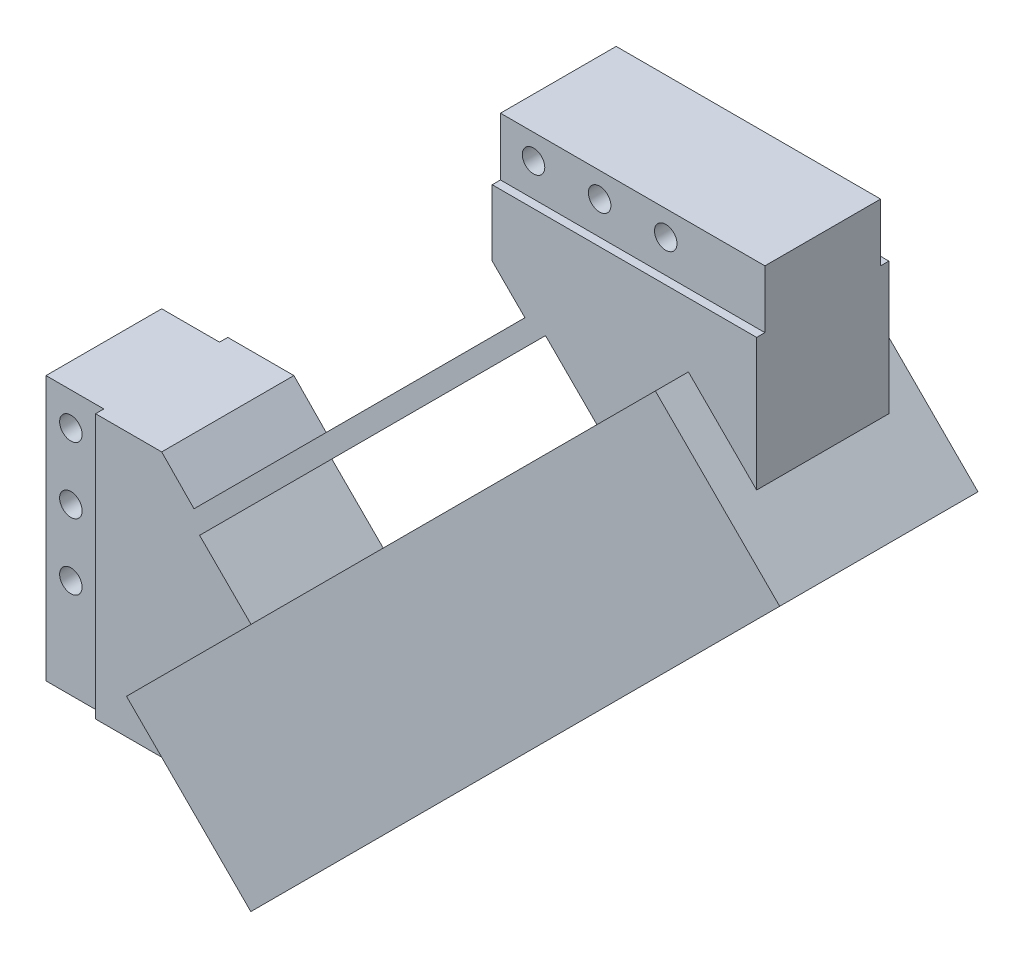
from build123d import *

# Parameters (mm, degrees)
SKETCH3_W                = 11.1125
SKETCH3_H                = 50.8
SKETCH3_W_2              = 50.8
SKETCH3_H_2              = 11.1125
BOSS_EXTRUDE2_DEPTH      = 25.4
SKETCH5_W                = 50.8
SKETCH5_H                = 12.7
SKETCH5_W_2              = 12.7
SKETCH5_H_2              = 50.8
CUT_EXTRUDE1_DEPTH       = 1.5875
SKETCH6_W                = 50.8
SKETCH6_H                = 12.7
SKETCH6_W_2              = 12.7
SKETCH6_H_2              = 50.8
CUT_EXTRUDE2_DEPTH       = 1.5875
SKETCH7_R                = 2.159
CUT_EXTRUDE4_DEPTH       = 25.4
F_3DSKETCH2_R            = 11.1125
F_3DSKETCH2_R_2          = 4.572
F_3DSKETCH2_R_3          = 19.05
F_3DSKETCH2_R_4          = 2.413
BOSS_EXTRUDE5_DEPTH      = 18.539434278
CUT_EXTRUDE9_START       = 89.71230509
CUT_EXTRUDE9_OUTLINE_R   = 4.572
CUT_EXTRUDE9_DEPTH       = 36.011280605
F_3DSKETCH2_11_R         = 2.413
CUT_EXTRUDE10_DEPTH      = 36.011280605
BOSS_EXTRUDE7_START      = -21.079434
SKETCH10_W               = 38.1
SKETCH10_H               = 143.684097938
SKETCH10_R               = 4.572
BOSS_EXTRUDE7_DEPTH      = 33.779434
CUT_EXTRUDE13_DEPTH      = 12.7
CUT_EXTRUDE13_DEPTH_BACK = 2.54
CUT_EXTRUDE14_DEPTH      = 12.7


# Read off the part's stored shape, not the designer's step: Cut-Extrude9
with BuildPart() as part:
    # Sketch3 → Boss-Extrude2 (new body)
    # profile 1 of 3: a face of its own
    with BuildSketch(Plane.XY):
        Polygon((139.7, -12.7), (88.9, -12.7), (88.9, -25.4), (95.186179285, -31.686179285), (92.898197138, -33.974161432), (33.974161432, -92.898197138), (31.605965948, -95.266392622), (25.4, -88.9), (12.7, -88.9), (12.7, -139.7), (38.1, -139.7), (139.7, -38.1), align=None)
        Polygon((109.017587951, -42.563692655), (42.563692655, -109.017587951), (35.379487758, -101.833383054), (32.685410922, -99.139306217), (42.563692655, -89.261024484), (89.261024484, -42.563692655), (99.139306217, -32.685410922), (101.833383054, -35.379487758), align=None, mode=Mode.SUBTRACT)
    # profile 2 of 3: a face of its own
    with BuildSketch(Plane.XY):
        with Locations((7.14375, -114.3)):
            Rectangle(SKETCH3_W, SKETCH3_H)
    # profile 3 of 3: a face of its own
    with BuildSketch(Plane.XY):
        with Locations((114.3, -7.14375)):
            Rectangle(SKETCH3_W_2, SKETCH3_H_2)
    extrude(amount=BOSS_EXTRUDE2_DEPTH)

    # Sketch5 → Cut-Extrude1 (cut)
    with BuildSketch(Plane.XY.offset(25.4)):
        with Locations((114.3, -6.35)):
            Rectangle(SKETCH5_W, SKETCH5_H)
        with Locations((6.35, -114.3)):
            Rectangle(SKETCH5_W_2, SKETCH5_H_2)
    extrude(amount=-CUT_EXTRUDE1_DEPTH, mode=Mode.SUBTRACT)

    # Sketch6 → Cut-Extrude2 (cut)
    with BuildSketch(Plane(origin=(0, 0, 0), x_dir=(-1, 0, 0), z_dir=(0, 0, -1))):
        with Locations((-114.3, -6.35)):
            Rectangle(SKETCH6_W, SKETCH6_H)
        with Locations((-6.35, -114.3)):
            Rectangle(SKETCH6_W_2, SKETCH6_H_2)
    extrude(amount=-CUT_EXTRUDE2_DEPTH, mode=Mode.SUBTRACT)

    # Sketch7 → Cut-Extrude4 (cut)
    with BuildSketch(Plane.XY.offset(25.4)):
        with Locations((95.25, -6.3627)):
            Circle(SKETCH7_R)
        with Locations((107.95, -6.3627)):
            Circle(SKETCH7_R)
        with Locations((120.65, -6.3627)):
            Circle(SKETCH7_R)
        with Locations((6.3627, -95.25)):
            Circle(SKETCH7_R)
        with Locations((6.3627, -107.95)):
            Circle(SKETCH7_R)
        with Locations((6.3627, -120.65)):
            Circle(SKETCH7_R)
    extrude(amount=-CUT_EXTRUDE4_DEPTH, mode=Mode.SUBTRACT)

    # 3DSketch2 → Boss-Extrude5 (add)
    # profile 1 of 3: a face of its own
    with BuildSketch(Plane(origin=(139.7, -38.1, 25.4), x_dir=(-0.6963106238227913, -0.6963106238227915, -0.17407765595569788), z_dir=(0.7071067811865477, -0.7071067811865475, 0))):
        with Locations((72.955945611, 0)):
            Circle(F_3DSKETCH2_R)
        with Locations((72.955945611, 0)):
            Circle(F_3DSKETCH2_R_2, mode=Mode.SUBTRACT)
    # profile 2 of 3: a face of its own
    with BuildSketch(Plane(origin=(139.7, -38.1, 25.4), x_dir=(-0.6963106238227913, -0.6963106238227915, -0.17407765595569788), z_dir=(0.7071067811865477, -0.7071067811865475, 0))):
        with Locations((72.955945611, 0)):
            Circle(F_3DSKETCH2_R_3)
    # profile 3 of 3: a face of its own
    with BuildSketch(Plane(origin=(139.7, -38.1, 25.4), x_dir=(-0.6963106238227913, -0.6963106238227915, -0.17407765595569788), z_dir=(0.7071067811865477, -0.7071067811865475, 0))):
        Polygon((0, 0), (4.421572461, 25.012190967), (145.911891222, 0), (141.490318761, -25.012190967), align=None)
        with Locations((47.943754644, 4.421572461)):
            Circle(F_3DSKETCH2_R_4, mode=Mode.SUBTRACT)
        with Locations((97.968136578, -4.421572461)):
            Circle(F_3DSKETCH2_R_4, mode=Mode.SUBTRACT)
    extrude(amount=-BOSS_EXTRUDE5_DEPTH)

    # Cut-Extrude9 outline → Cut-Extrude9 (cut)
    with BuildSketch(Plane(origin=(0, 0, 0), x_dir=(0.7071067811865471, 0.707106781186548, 0), z_dir=(0.707106781186548, -0.707106781186547, 0)).offset(CUT_EXTRUDE9_START)):
        with Locations((0, 12.7)):
            Circle(CUT_EXTRUDE9_OUTLINE_R)
    extrude(amount=CUT_EXTRUDE9_DEPTH, mode=Mode.SUBTRACT)

    # 3DSketch2<11> → Cut-Extrude10 (cut)
    with BuildSketch(Plane(origin=(106.860512242, -70.939487758, 12.7), x_dir=(-0.7071067811865474, -0.7071067811865477, 0), z_dir=(-0.7071067811865477, 0.7071067811865474, 0))):
        Circle(F_3DSKETCH2_11_R)
        with Locations((50.8, 0)):
            Circle(F_3DSKETCH2_11_R)
    extrude(amount=CUT_EXTRUDE10_DEPTH, mode=Mode.SUBTRACT)

    # Sketch10 → Boss-Extrude7 (add)
    with BuildSketch(Plane(origin=(90.696051224, -90.696051224, 0), x_dir=(0, 0, -1), z_dir=(0.7071067811865477, -0.7071067811865474, 0)).offset(BOSS_EXTRUDE7_START)):
        with Locations((-12.7, 0)):
            Rectangle(SKETCH10_W, SKETCH10_H)
        with BuildLine():
            Line((-17.581565793, -48.718798516), (-19.911684225, -26.144386078))
            ThreePointArc((-19.911684225, -26.144386078), (-12.7, -18.15), (-5.488315775, -26.144386078))
            Line((-5.488315775, -26.144386078), (-7.818434207, -48.718798516))
            ThreePointArc((-7.818434207, -48.718798516), (-12.7, -58.513994518), (-17.581565793, -48.718798516))
        make_face(mode=Mode.SUBTRACT)
        with Locations(Location((-12.7, 0, 0), (0, 0, 270))):
            Circle(SKETCH10_R, mode=Mode.SUBTRACT)
        with BuildLine():
            ThreePointArc((-17.581565793, 48.718798516), (-12.7, 58.513994518), (-7.818434207, 48.718798516))
            Line((-7.818434207, 48.718798516), (-5.488315775, 26.144386078))
            ThreePointArc((-5.488315775, 26.144386078), (-12.7, 18.15), (-19.911684225, 26.144386078))
            Line((-19.911684225, 26.144386078), (-17.581565793, 48.718798516))
        make_face(mode=Mode.SUBTRACT)
    extrude(amount=BOSS_EXTRUDE7_DEPTH)

    # Sketch10<7> → Cut-Extrude13 (cut, two sides: drawn at the far end of the back side and taken through both)
    with BuildSketch(Plane(origin=(90.696051224, -90.696051224, 0), x_dir=(0, 0, -1), z_dir=(0.7071067811865477, -0.7071067811865474, 0)).offset(-CUT_EXTRUDE13_DEPTH_BACK)):
        with BuildLine():
            Line((-25.6, -66.75), (0.2, -66.75))
            ThreePointArc((0.2, -66.75), (2.745584412, -65.695584412), (3.8, -63.15))
            Line((3.8, -63.15), (3.8, -13.05))
            ThreePointArc((3.8, -13.05), (2.745584412, -10.504415588), (0.2, -9.45))
            Line((0.2, -9.45), (-25.6, -9.45))
            ThreePointArc((-25.6, -9.45), (-28.145584412, -10.504415588), (-29.2, -13.05))
            Line((-29.2, -13.05), (-29.2, -63.15))
            ThreePointArc((-29.2, -63.15), (-28.145584412, -65.695584412), (-25.6, -66.75))
        make_face()
        with BuildLine():
            Line((0.2, 66.75), (-25.6, 66.75))
            ThreePointArc((-25.6, 66.75), (-28.145584412, 65.695584412), (-29.2, 63.15))
            Line((-29.2, 63.15), (-29.2, 13.05))
            ThreePointArc((-29.2, 13.05), (-28.145584412, 10.504415588), (-25.6, 9.45))
            Line((-25.6, 9.45), (0.2, 9.45))
            ThreePointArc((0.2, 9.45), (2.745584412, 10.504415588), (3.8, 13.05))
            Line((3.8, 13.05), (3.8, 63.15))
            ThreePointArc((3.8, 63.15), (2.745584412, 65.695584412), (0.2, 66.75))
        make_face()
    extrude(amount=CUT_EXTRUDE13_DEPTH + CUT_EXTRUDE13_DEPTH_BACK, mode=Mode.SUBTRACT)

    # Sketch10<8> → Cut-Extrude14 (cut)
    with BuildSketch(Plane(origin=(90.696051224, -90.696051224, 0), x_dir=(0, 0, -1), z_dir=(0.7071067811865477, -0.7071067811865474, 0))):
        with BuildLine():
            add(Edge.make_bspline(
                [(-15.540519599, 47.781955136), (-15.490532425, 47.73603869), (-15.388993168, 47.642768327), (-15.225337809, 47.510512218), (-15.05023378, 47.382424784), (-14.86286402, 47.260384175), (-14.663387192, 47.145452755), (-14.451810526, 47.038984645), (-14.180735408, 46.921767894), (-13.850558642, 46.808614587), (-13.464394399, 46.717629172), (-13.080676116, 46.662280095), (-12.825830882, 46.655545496), (-12.7, 46.65222026)],
                knots=[0, 0, 0, 0, 0.065342869, 0.132731377, 0.202172121, 0.273671089, 0.34723372, 0.422864961, 0.500569311, 0.630039386, 0.756419003, 0.879730881, 1, 1, 1, 1], degree=3))
            add(Edge.make_bspline(
                [(-12.7, 46.65222026), (-12.637418818, 46.653041537), (-12.511461207, 46.654694528), (-12.321734755, 46.668182489), (-12.130453667, 46.690076129), (-11.938071537, 46.721452131), (-11.745069681, 46.762353225), (-11.551961199, 46.813076509), (-11.359273202, 46.873817711), (-11.100574854, 46.96958434), (-10.788967012, 47.112379165), (-10.442976836, 47.31548274), (-10.132363887, 47.536777354), (-9.948826409, 47.701680377), (-9.859480401, 47.781955136)],
                knots=[0, 0, 0, 0, 0.059829934, 0.120420154, 0.181774032, 0.243894787, 0.306785488, 0.370449065, 0.434888311, 0.500105888, 0.634537507, 0.762645389, 0.884455823, 1, 1, 1, 1], degree=3))
            add(Edge.make_bspline(
                [(-9.859480401, 47.781955136), (-9.809926557, 47.830159757), (-9.712743706, 47.92469657), (-9.578577735, 48.072553471), (-9.456054231, 48.219998795), (-9.345191562, 48.366676585), (-9.21391821, 48.556721871), (-9.07151754, 48.793288336), (-8.927291666, 49.077918239), (-8.851279796, 49.271154552), (-8.81418569, 49.365454672)],
                knots=[0, 0, 0, 0, 0.108779889, 0.213334401, 0.313672693, 0.409804769, 0.501741655, 0.675682941, 0.841731935, 1, 1, 1, 1], degree=3))
            ThreePointArc((-8.81418569, 49.365454672), (-12.7, 54.942158031), (-16.58581431, 49.365454672))
            add(Edge.make_bspline(
                [(-16.58581431, 49.365454672), (-16.564153735, 49.308979836), (-16.520186479, 49.194345595), (-16.44362516, 49.023848207), (-16.357540355, 48.851983288), (-16.26071672, 48.679725849), (-16.137389358, 48.482854283), (-15.978837203, 48.261270581), (-15.776448009, 48.015668653), (-15.620912994, 47.861593799), (-15.540519599, 47.781955136)],
                knots=[0, 0, 0, 0, 0.094498647, 0.191816063, 0.291978629, 0.395010761, 0.500935114, 0.655694233, 0.822034222, 1, 1, 1, 1], degree=3))
        make_face()
        with BuildLine():
            ThreePointArc((-23.375261528, 35.545722635), (-25.960415941, 31.807672398), (-27.282722774, 27.45939141))
            Line((-27.282722774, 27.45939141), (-27.734823926, 25.480918405))
            ThreePointArc((-27.734823926, 25.480918405), (-27.742354252, 25.436649043), (-27.74487495, 25.391814589))
            Line((-27.74487495, 25.391814589), (-27.74487495, 17.827902311))
            add(Edge.make_bspline(
                [(-27.74487495, 17.827902311), (-27.74487495, 17.697556499), (-27.677913043, 17.571268418), (-27.464315845, 17.424786106), (-27.323061319, 17.407781693), (-27.201392579, 17.454544234)],
                knots=[0, 0, 0, 0, 0.000387965, 0.000387965, 0.00077593, 0.00077593, 0.00077593, 0.00077593], degree=3, weights=[1, 1, 1, 1, 1, 1]))
            ThreePointArc((-27.201392579, 17.454544234), (-25.735153586, 17.161089301), (-25.37342862, 15.710183504))
            add(Edge.make_bspline(
                [(-25.37342862, 15.710183504), (-25.405194241, 15.614372263), (-25.398958784, 15.508171677), (-25.315527042, 15.326534106), (-25.23920304, 15.252740582), (-25.145843703, 15.214362493)],
                knots=[0, 0, 0, 0, 0.000301952, 0.000301952, 0.000603904, 0.000603904, 0.000603904, 0.000603904], degree=3, weights=[1, 1, 1, 1, 1, 1]))
            ThreePointArc((-25.145843703, 15.214362493), (-24.439786176, 14.792159607), (-23.888695899, 14.181363394))
            add(Edge.make_bspline(
                [(-23.888695899, 14.181363394), (-23.84058364, 14.108747016), (-23.826397589, 14.016819684), (-23.850380907, 13.93307766)],
                knots=[0, 0, 0, 0, 0.000257617, 0.000257617, 0.000257617, 0.000257617], degree=3, weights=[1, 1, 1, 1]))
            ThreePointArc((-23.850380907, 13.93307766), (-23.575139467, 11.978075507), (-21.938295824, 10.874203161))
            Line((-21.938295824, 10.874203161), (-20.446740514, 10.611201717))
            ThreePointArc((-20.446740514, 10.611201717), (-20.412144857, 10.606647112), (-20.377283888, 10.60512505))
            Line((-20.377283888, 10.60512505), (-5.022716112, 10.60512505))
            ThreePointArc((-5.022716112, 10.60512505), (-4.987855143, 10.606647112), (-4.953259486, 10.611201717))
            Line((-4.953259486, 10.611201717), (-3.461704176, 10.874203161))
            ThreePointArc((-3.461704176, 10.874203161), (-1.824860533, 11.978075507), (-1.549619093, 13.93307766))
            add(Edge.make_bspline(
                [(-1.549619093, 13.93307766), (-1.573602413, 14.016819693), (-1.559416355, 14.108747024), (-1.511304101, 14.181363394)],
                knots=[0, 0, 0, 0, 0.000257617, 0.000257617, 0.000257617, 0.000257617], degree=3, weights=[1, 1, 1, 1]))
            ThreePointArc((-1.511304101, 14.181363394), (-0.960213824, 14.792159607), (-0.254156297, 15.214362493))
            add(Edge.make_bspline(
                [(-0.254156297, 15.214362493), (-0.160796937, 15.252740591), (-0.084334773, 15.326706684), (-0.001000449, 15.50838897), (0.005194234, 15.614372286), (-0.02657138, 15.710183504)],
                knots=[0, 0, 0, 0, 0.000301952, 0.000301952, 0.000603904, 0.000603904, 0.000603904, 0.000603904], degree=3, weights=[1, 1, 1, 1, 1, 1]))
            ThreePointArc((-0.02657138, 15.710183504), (0.335153586, 17.161089301), (1.801392579, 17.454544234))
            add(Edge.make_bspline(
                [(1.801392579, 17.454544234), (1.923061366, 17.407781675), (2.06496564, 17.42497916), (2.278326365, 17.571805697), (2.34487495, 17.697556549), (2.34487495, 17.827902311)],
                knots=[0, 0, 0, 0, 0.000387965, 0.000387965, 0.00077593, 0.00077593, 0.00077593, 0.00077593], degree=3, weights=[1, 1, 1, 1, 1, 1]))
            Line((2.34487495, 17.827902311), (2.34487495, 25.391814589))
            ThreePointArc((2.34487495, 25.391814589), (2.342354252, 25.436649043), (2.334823926, 25.480918405))
            Line((2.334823926, 25.480918405), (1.882722774, 27.45939141))
            ThreePointArc((1.882722774, 27.45939141), (0.560415941, 31.807672398), (-2.024738472, 35.545722635))
            add(Edge.make_bspline(
                [(-2.024738472, 35.545722635), (-2.073045795, 35.596551277), (-2.101978364, 35.662728517), (-2.111257506, 35.802216956), (-2.091202658, 35.871983484), (-2.049985751, 35.92871369)],
                knots=[0, 0, 0, 0, 0.000207381, 0.000207381, 0.000414763, 0.000414763, 0.000414763, 0.000414763], degree=3, weights=[1, 1, 1, 1, 1, 1]))
            Line((-2.049985751, 35.92871369), (-1.919397276, 36.108453306))
            ThreePointArc((-1.919397276, 36.108453306), (-2.456419606, 39.499078855), (-5.847045155, 38.962056525))
            Line((-5.847045155, 38.962056525), (-6.037411672, 38.700039494))
            add(Edge.make_bspline(
                [(-6.037411672, 38.700039494), (-6.078590921, 38.643361119), (-6.138347451, 38.602917009), (-6.273703714, 38.568422661), (-6.345876647, 38.575410319), (-6.40912486, 38.605540598)],
                knots=[0, 0, 0, 0, 0.000207192, 0.000207192, 0.000414384, 0.000414384, 0.000414384, 0.000414384], degree=3, weights=[1, 1, 1, 1, 1, 1]))
            ThreePointArc((-6.40912486, 38.605540598), (-12.7, 40.027419885), (-18.99087514, 38.605540598))
            add(Edge.make_bspline(
                [(-18.99087514, 38.605540598), (-19.054123344, 38.575410324), (-19.125940061, 38.568415461), (-19.261336137, 38.602753207), (-19.321409073, 38.643361112), (-19.362588328, 38.700039494)],
                knots=[0, 0, 0, 0, 0.000207192, 0.000207192, 0.000414384, 0.000414384, 0.000414384, 0.000414384], degree=3, weights=[1, 1, 1, 1, 1, 1]))
            Line((-19.362588328, 38.700039494), (-19.552954845, 38.962056525))
            ThreePointArc((-19.552954845, 38.962056525), (-22.943580394, 39.499078855), (-23.480602724, 36.108453306))
            Line((-23.480602724, 36.108453306), (-23.350014249, 35.92871369))
            add(Edge.make_bspline(
                [(-23.350014249, 35.92871369), (-23.308797348, 35.871983492), (-23.288802383, 35.802580884), (-23.297914493, 35.663081434), (-23.326954198, 35.596551285), (-23.375261528, 35.545722635)],
                knots=[0, 0, 0, 0, 0.000207381, 0.000207381, 0.000414763, 0.000414763, 0.000414763, 0.000414763], degree=3, weights=[1, 1, 1, 1, 1, 1]))
        make_face()
        with BuildLine():
            Line((-27.74487495, -17.827902311), (-27.74487495, -25.391814589))
            ThreePointArc((-27.74487495, -25.391814589), (-27.742354252, -25.436649043), (-27.734823926, -25.480918405))
            Line((-27.734823926, -25.480918405), (-27.282722774, -27.45939141))
            ThreePointArc((-27.282722774, -27.45939141), (-25.960415941, -31.807672398), (-23.375261528, -35.545722635))
            add(Edge.make_bspline(
                [(-23.375261528, -35.545722635), (-23.326954205, -35.596551277), (-23.298021636, -35.662728517), (-23.288742494, -35.802216956), (-23.308797342, -35.871983484), (-23.350014249, -35.92871369)],
                knots=[0, 0, 0, 0, 0.000207381, 0.000207381, 0.000414763, 0.000414763, 0.000414763, 0.000414763], degree=3, weights=[1, 1, 1, 1, 1, 1]))
            Line((-23.350014249, -35.92871369), (-23.480602724, -36.108453306))
            ThreePointArc((-23.480602724, -36.108453306), (-22.943580394, -39.499078855), (-19.552954845, -38.962056525))
            Line((-19.552954845, -38.962056525), (-19.362588328, -38.700039494))
            add(Edge.make_bspline(
                [(-19.362588328, -38.700039494), (-19.321409079, -38.643361119), (-19.261652549, -38.602917009), (-19.126296286, -38.568422661), (-19.054123353, -38.575410319), (-18.99087514, -38.605540598)],
                knots=[0, 0, 0, 0, 0.000207192, 0.000207192, 0.000414384, 0.000414384, 0.000414384, 0.000414384], degree=3, weights=[1, 1, 1, 1, 1, 1]))
            ThreePointArc((-18.99087514, -38.605540598), (-12.7, -40.027419885), (-6.40912486, -38.605540598))
            add(Edge.make_bspline(
                [(-6.40912486, -38.605540598), (-6.345876656, -38.575410324), (-6.274059939, -38.568415461), (-6.138663863, -38.602753207), (-6.078590927, -38.643361112), (-6.037411672, -38.700039494)],
                knots=[0, 0, 0, 0, 0.000207192, 0.000207192, 0.000414384, 0.000414384, 0.000414384, 0.000414384], degree=3, weights=[1, 1, 1, 1, 1, 1]))
            Line((-6.037411672, -38.700039494), (-5.847045155, -38.962056525))
            ThreePointArc((-5.847045155, -38.962056525), (-2.456419606, -39.499078855), (-1.919397276, -36.108453306))
            Line((-1.919397276, -36.108453306), (-2.049985751, -35.92871369))
            add(Edge.make_bspline(
                [(-2.049985751, -35.92871369), (-2.091202652, -35.871983492), (-2.111197617, -35.802580884), (-2.102085507, -35.663081434), (-2.073045802, -35.596551285), (-2.024738472, -35.545722635)],
                knots=[0, 0, 0, 0, 0.000207381, 0.000207381, 0.000414763, 0.000414763, 0.000414763, 0.000414763], degree=3, weights=[1, 1, 1, 1, 1, 1]))
            ThreePointArc((-2.024738472, -35.545722635), (0.560415941, -31.807672398), (1.882722774, -27.45939141))
            Line((1.882722774, -27.45939141), (2.334823926, -25.480918405))
            ThreePointArc((2.334823926, -25.480918405), (2.342354252, -25.436649043), (2.34487495, -25.391814589))
            Line((2.34487495, -25.391814589), (2.34487495, -17.827902311))
            add(Edge.make_bspline(
                [(2.34487495, -17.827902311), (2.34487495, -17.697556499), (2.277913043, -17.571268418), (2.064315845, -17.424786106), (1.923061319, -17.407781693), (1.801392579, -17.454544234)],
                knots=[0, 0, 0, 0, 0.000387965, 0.000387965, 0.00077593, 0.00077593, 0.00077593, 0.00077593], degree=3, weights=[1, 1, 1, 1, 1, 1]))
            ThreePointArc((1.801392579, -17.454544234), (0.335153586, -17.161089301), (-0.02657138, -15.710183504))
            add(Edge.make_bspline(
                [(-0.02657138, -15.710183504), (0.005194241, -15.614372263), (-0.001041216, -15.508171677), (-0.084472958, -15.326534106), (-0.16079696, -15.252740582), (-0.254156297, -15.214362493)],
                knots=[0, 0, 0, 0, 0.000301952, 0.000301952, 0.000603904, 0.000603904, 0.000603904, 0.000603904], degree=3, weights=[1, 1, 1, 1, 1, 1]))
            ThreePointArc((-0.254156297, -15.214362493), (-0.960213824, -14.792159607), (-1.511304101, -14.181363394))
            add(Edge.make_bspline(
                [(-1.511304101, -14.181363394), (-1.55941636, -14.108747016), (-1.573602411, -14.016819684), (-1.549619093, -13.93307766)],
                knots=[0, 0, 0, 0, 0.000257617, 0.000257617, 0.000257617, 0.000257617], degree=3, weights=[1, 1, 1, 1]))
            ThreePointArc((-1.549619093, -13.93307766), (-1.824860533, -11.978075507), (-3.461704176, -10.874203161))
            Line((-3.461704176, -10.874203161), (-4.953259486, -10.611201717))
            ThreePointArc((-4.953259486, -10.611201717), (-4.987855143, -10.606647112), (-5.022716112, -10.60512505))
            Line((-5.022716112, -10.60512505), (-20.377283888, -10.60512505))
            ThreePointArc((-20.377283888, -10.60512505), (-20.412144857, -10.606647112), (-20.446740514, -10.611201717))
            Line((-20.446740514, -10.611201717), (-21.938295824, -10.874203161))
            ThreePointArc((-21.938295824, -10.874203161), (-23.575139467, -11.978075507), (-23.850380907, -13.93307766))
            add(Edge.make_bspline(
                [(-23.850380907, -13.93307766), (-23.826397587, -14.016819693), (-23.840583645, -14.108747024), (-23.888695899, -14.181363394)],
                knots=[0, 0, 0, 0, 0.000257617, 0.000257617, 0.000257617, 0.000257617], degree=3, weights=[1, 1, 1, 1]))
            ThreePointArc((-23.888695899, -14.181363394), (-24.439786176, -14.792159607), (-25.145843703, -15.214362493))
            add(Edge.make_bspline(
                [(-25.145843703, -15.214362493), (-25.239203063, -15.252740591), (-25.315665227, -15.326706684), (-25.398999551, -15.50838897), (-25.405194234, -15.614372286), (-25.37342862, -15.710183504)],
                knots=[0, 0, 0, 0, 0.000301952, 0.000301952, 0.000603904, 0.000603904, 0.000603904, 0.000603904], degree=3, weights=[1, 1, 1, 1, 1, 1]))
            ThreePointArc((-25.37342862, -15.710183504), (-25.735153586, -17.161089301), (-27.201392579, -17.454544234))
            add(Edge.make_bspline(
                [(-27.201392579, -17.454544234), (-27.323061366, -17.407781675), (-27.46496564, -17.42497916), (-27.678326365, -17.571805697), (-27.74487495, -17.697556549), (-27.74487495, -17.827902311)],
                knots=[0, 0, 0, 0, 0.000387965, 0.000387965, 0.00077593, 0.00077593, 0.00077593, 0.00077593], degree=3, weights=[1, 1, 1, 1, 1, 1]))
        make_face()
        with BuildLine():
            ThreePointArc((-16.58581431, -49.365454672), (-12.7, -54.942158031), (-8.81418569, -49.365454672))
            add(Edge.make_bspline(
                [(-8.81418569, -49.365454672), (-8.835846265, -49.308979836), (-8.879813521, -49.194345595), (-8.95637484, -49.023848207), (-9.042459645, -48.851983288), (-9.13928328, -48.679725849), (-9.262610642, -48.482854283), (-9.421162797, -48.261270581), (-9.623551991, -48.015668653), (-9.779087006, -47.861593799), (-9.859480401, -47.781955136)],
                knots=[0, 0, 0, 0, 0.094498647, 0.191816063, 0.291978629, 0.395010761, 0.500935114, 0.655694233, 0.822034222, 1, 1, 1, 1], degree=3))
            add(Edge.make_bspline(
                [(-9.859480401, -47.781955136), (-9.909467575, -47.73603869), (-10.011006832, -47.642768327), (-10.174662191, -47.510512218), (-10.34976622, -47.382424784), (-10.53713598, -47.260384175), (-10.736612808, -47.145452755), (-10.948189474, -47.038984645), (-11.219264592, -46.921767894), (-11.549441358, -46.808614587), (-11.935605601, -46.717629172), (-12.319323884, -46.662280095), (-12.574169118, -46.655545496), (-12.7, -46.65222026)],
                knots=[0, 0, 0, 0, 0.065342869, 0.132731377, 0.202172121, 0.273671089, 0.34723372, 0.422864961, 0.500569311, 0.630039386, 0.756419003, 0.879730881, 1, 1, 1, 1], degree=3))
            add(Edge.make_bspline(
                [(-12.7, -46.65222026), (-12.762581182, -46.653041537), (-12.888538793, -46.654694528), (-13.078265245, -46.668182489), (-13.269546333, -46.690076129), (-13.461928463, -46.721452131), (-13.654930319, -46.762353225), (-13.848038801, -46.813076509), (-14.040726798, -46.873817711), (-14.299425146, -46.96958434), (-14.611032988, -47.112379165), (-14.957023164, -47.31548274), (-15.267636113, -47.536777354), (-15.451173591, -47.701680377), (-15.540519599, -47.781955136)],
                knots=[0, 0, 0, 0, 0.059829934, 0.120420154, 0.181774032, 0.243894787, 0.306785488, 0.370449065, 0.434888311, 0.500105888, 0.634537507, 0.762645389, 0.884455823, 1, 1, 1, 1], degree=3))
            add(Edge.make_bspline(
                [(-15.540519599, -47.781955136), (-15.590073443, -47.830159757), (-15.687256294, -47.92469657), (-15.821422265, -48.072553471), (-15.943945769, -48.219998795), (-16.054808438, -48.366676585), (-16.18608179, -48.556721871), (-16.32848246, -48.793288336), (-16.472708334, -49.077918239), (-16.548720204, -49.271154552), (-16.58581431, -49.365454672)],
                knots=[0, 0, 0, 0, 0.108779889, 0.213334401, 0.313672693, 0.409804769, 0.501741655, 0.675682941, 0.841731935, 1, 1, 1, 1], degree=3))
        make_face()
    extrude(amount=-CUT_EXTRUDE14_DEPTH, mode=Mode.SUBTRACT)


solid = part.part
